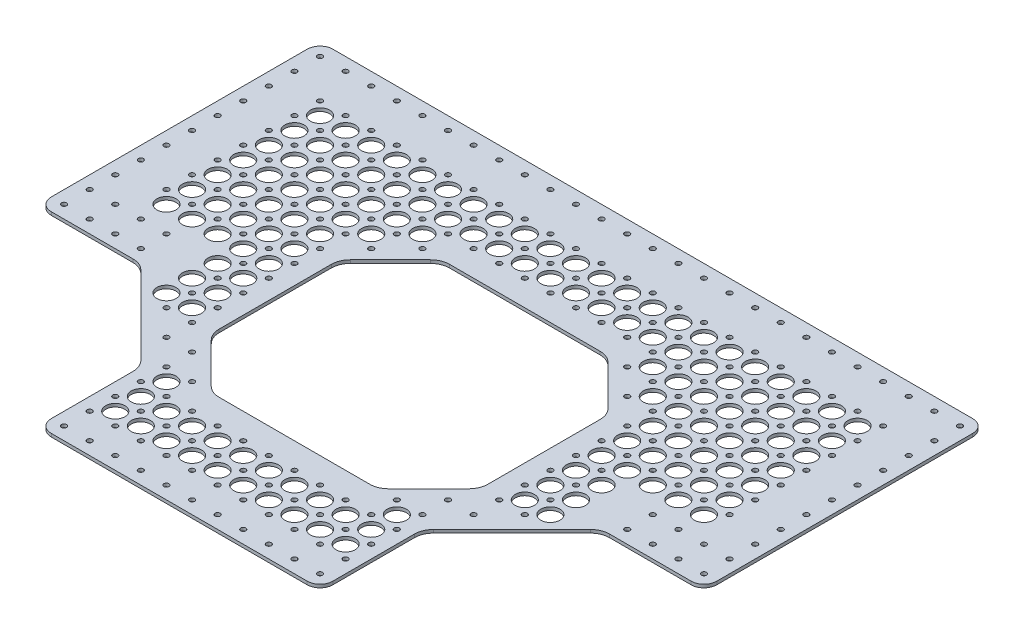
from build123d import *

# Parameters (mm, degrees)
SKETCH1_R           = 2.54
BOSS_EXTRUDE1_DEPTH = 3.175
SKETCH2_W           = 762
SKETCH2_H           = 25.4
CUT_EXTRUDE1_DEPTH  = 241.3
SKETCH3_W           = 266.7
SKETCH3_H           = 177.8
CUT_EXTRUDE2_DEPTH  = 3.175
BOSS_EXTRUDE2_DEPTH = 3.175
CUT_EXTRUDE3_DEPTH  = 3.175
SKETCH8_R           = 2.54
SKETCH8_R_2         = 9.525
CUT_EXTRUDE5_DEPTH  = 3.175
FILLET1_R           = 12.7
FILLET2_R           = 19.05


with BuildPart() as part:
    # Sketch1 → Boss-Extrude1 (new body)
    with BuildSketch(Plane(origin=(0, 0, 0), x_dir=(1, 0, 0), z_dir=(0, 1, 0))):
        Polygon((0, 101.6), (0, 0), (-88.904535599, -88.904535599), (-177.804535599, -88.904535599), (-190.504535599, -88.904535599), (-190.504535599, -419.104535599), (-177.804535599, -419.104535599), (-88.904535599, -419.104535599), (0, -508.009071197), (0, -609.609071197), (279.4, -609.609071197), (279.4, -508.009071197), (368.304535599, -419.104535599), (469.904535599, -419.104535599), (469.904535599, -88.904535599), (368.304535599, -88.904535599), (279.4, 0), (279.4, 101.6), align=None)
        with Locations((12.7, -596.909071197)):
            Circle(SKETCH1_R, mode=Mode.SUBTRACT)
        with Locations((38.1, -596.909071197)):
            Circle(SKETCH1_R, mode=Mode.SUBTRACT)
        with Locations((63.5, -596.909071197)):
            Circle(SKETCH1_R, mode=Mode.SUBTRACT)
        with Locations((88.9, -596.909071197)):
            Circle(SKETCH1_R, mode=Mode.SUBTRACT)
        with Locations((114.3, -596.909071197)):
            Circle(SKETCH1_R, mode=Mode.SUBTRACT)
        with Locations((139.7, -596.909071197)):
            Circle(SKETCH1_R, mode=Mode.SUBTRACT)
        with Locations((-177.804535599, -406.404535599)):
            Circle(SKETCH1_R, mode=Mode.SUBTRACT)
        with Locations((-152.404535599, -406.404535599)):
            Circle(SKETCH1_R, mode=Mode.SUBTRACT)
        with Locations((-127.004535599, -406.404535599)):
            Circle(SKETCH1_R, mode=Mode.SUBTRACT)
        with Locations((-177.804535599, -381.004535599)):
            Circle(SKETCH1_R, mode=Mode.SUBTRACT)
        with Locations((-152.404535599, -381.004535599)):
            Circle(SKETCH1_R, mode=Mode.SUBTRACT)
        with Locations((-177.804535599, -355.604535599)):
            Circle(SKETCH1_R, mode=Mode.SUBTRACT)
        with Locations((-127.004535599, -381.004535599)):
            Circle(SKETCH1_R, mode=Mode.SUBTRACT)
        with Locations((-101.604535599, -406.404535599)):
            Circle(SKETCH1_R, mode=Mode.SUBTRACT)
        with Locations((-101.604535599, -381.004535599)):
            Circle(SKETCH1_R, mode=Mode.SUBTRACT)
        with Locations((-177.804535599, -330.204535599)):
            Circle(SKETCH1_R, mode=Mode.SUBTRACT)
        with Locations((-177.804535599, -304.804535599)):
            Circle(SKETCH1_R, mode=Mode.SUBTRACT)
        with Locations((-177.804535599, -279.404535599)):
            Circle(SKETCH1_R, mode=Mode.SUBTRACT)
        with Locations((165.1, -596.909071197)):
            Circle(SKETCH1_R, mode=Mode.SUBTRACT)
        with Locations((190.5, -596.909071197)):
            Circle(SKETCH1_R, mode=Mode.SUBTRACT)
        with Locations((215.9, -596.909071197)):
            Circle(SKETCH1_R, mode=Mode.SUBTRACT)
        with Locations((241.3, -596.909071197)):
            Circle(SKETCH1_R, mode=Mode.SUBTRACT)
        with Locations((266.7, -596.909071197)):
            Circle(SKETCH1_R, mode=Mode.SUBTRACT)
        with Locations((381.004535599, -406.404535599)):
            Circle(SKETCH1_R, mode=Mode.SUBTRACT)
        with Locations((381.004535599, -381.004535599)):
            Circle(SKETCH1_R, mode=Mode.SUBTRACT)
        with Locations((406.404535599, -406.404535599)):
            Circle(SKETCH1_R, mode=Mode.SUBTRACT)
        with Locations((431.804535599, -406.404535599)):
            Circle(SKETCH1_R, mode=Mode.SUBTRACT)
        with Locations((457.204535599, -406.404535599)):
            Circle(SKETCH1_R, mode=Mode.SUBTRACT)
        with Locations((406.404535599, -381.004535599)):
            Circle(SKETCH1_R, mode=Mode.SUBTRACT)
        with Locations((431.804535599, -381.004535599)):
            Circle(SKETCH1_R, mode=Mode.SUBTRACT)
        with Locations((457.204535599, -381.004535599)):
            Circle(SKETCH1_R, mode=Mode.SUBTRACT)
        with Locations((457.204535599, -355.604535599)):
            Circle(SKETCH1_R, mode=Mode.SUBTRACT)
        with Locations((457.204535599, -330.204535599)):
            Circle(SKETCH1_R, mode=Mode.SUBTRACT)
        with Locations((457.204535599, -304.804535599)):
            Circle(SKETCH1_R, mode=Mode.SUBTRACT)
        with Locations((457.204535599, -279.404535599)):
            Circle(SKETCH1_R, mode=Mode.SUBTRACT)
        with Locations((-177.804535599, -254.004535599)):
            Circle(SKETCH1_R, mode=Mode.SUBTRACT)
        with Locations((-177.804535599, -228.604535599)):
            Circle(SKETCH1_R, mode=Mode.SUBTRACT)
        with Locations((-177.804535599, -203.204535599)):
            Circle(SKETCH1_R, mode=Mode.SUBTRACT)
        with Locations((-177.804535599, -177.804535599)):
            Circle(SKETCH1_R, mode=Mode.SUBTRACT)
        with Locations((-177.804535599, -152.404535599)):
            Circle(SKETCH1_R, mode=Mode.SUBTRACT)
        with Locations((-152.404535599, -152.404535599)):
            Circle(SKETCH1_R, mode=Mode.SUBTRACT)
        with Locations((-177.804535599, -127.004535599)):
            Circle(SKETCH1_R, mode=Mode.SUBTRACT)
        with Locations((-152.404535599, -127.004535599)):
            Circle(SKETCH1_R, mode=Mode.SUBTRACT)
        with Locations((-127.004535599, -152.404535599)):
            Circle(SKETCH1_R, mode=Mode.SUBTRACT)
        with Locations((-127.004535599, -127.004535599)):
            Circle(SKETCH1_R, mode=Mode.SUBTRACT)
        with Locations((-177.804535599, -101.604535599)):
            Circle(SKETCH1_R, mode=Mode.SUBTRACT)
        with Locations((-101.604535599, -152.404535599)):
            Circle(SKETCH1_R, mode=Mode.SUBTRACT)
        with Locations((-76.204535599, -152.404535599)):
            Circle(SKETCH1_R, mode=Mode.SUBTRACT)
        with Locations((-101.604535599, -127.004535599)):
            Circle(SKETCH1_R, mode=Mode.SUBTRACT)
        with Locations((-76.204535599, -127.004535599)):
            Circle(SKETCH1_R, mode=Mode.SUBTRACT)
        with Locations((-50.804535599, -152.404535599)):
            Circle(SKETCH1_R, mode=Mode.SUBTRACT)
        with Locations((-25.404535599, -152.404535599)):
            Circle(SKETCH1_R, mode=Mode.SUBTRACT)
        with Locations((-50.804535599, -127.004535599)):
            Circle(SKETCH1_R, mode=Mode.SUBTRACT)
        with Locations((-25.404535599, -127.004535599)):
            Circle(SKETCH1_R, mode=Mode.SUBTRACT)
        with Locations((-0.004535599, -152.404535599)):
            Circle(SKETCH1_R, mode=Mode.SUBTRACT)
        with Locations((-0.004535599, -127.004535599)):
            Circle(SKETCH1_R, mode=Mode.SUBTRACT)
        with Locations((25.395464401, -152.404535599)):
            Circle(SKETCH1_R, mode=Mode.SUBTRACT)
        with Locations((50.795464401, -152.404535599)):
            Circle(SKETCH1_R, mode=Mode.SUBTRACT)
        with Locations((25.395464401, -127.004535599)):
            Circle(SKETCH1_R, mode=Mode.SUBTRACT)
        with Locations((50.795464401, -127.004535599)):
            Circle(SKETCH1_R, mode=Mode.SUBTRACT)
        with Locations((76.195464401, -152.404535599)):
            Circle(SKETCH1_R, mode=Mode.SUBTRACT)
        with Locations((76.195464401, -127.004535599)):
            Circle(SKETCH1_R, mode=Mode.SUBTRACT)
        with Locations((101.595464401, -152.404535599)):
            Circle(SKETCH1_R, mode=Mode.SUBTRACT)
        with Locations((126.995464401, -152.404535599)):
            Circle(SKETCH1_R, mode=Mode.SUBTRACT)
        with Locations((101.595464401, -127.004535599)):
            Circle(SKETCH1_R, mode=Mode.SUBTRACT)
        with Locations((126.995464401, -127.004535599)):
            Circle(SKETCH1_R, mode=Mode.SUBTRACT)
        with Locations((12.7, 88.9)):
            Circle(SKETCH1_R, mode=Mode.SUBTRACT)
        with Locations((38.1, 88.9)):
            Circle(SKETCH1_R, mode=Mode.SUBTRACT)
        with Locations((63.5, 88.9)):
            Circle(SKETCH1_R, mode=Mode.SUBTRACT)
        with Locations((88.9, 88.9)):
            Circle(SKETCH1_R, mode=Mode.SUBTRACT)
        with Locations((114.3, 88.9)):
            Circle(SKETCH1_R, mode=Mode.SUBTRACT)
        with Locations((139.7, 88.9)):
            Circle(SKETCH1_R, mode=Mode.SUBTRACT)
        with Locations((152.395464401, -152.404535599)):
            Circle(SKETCH1_R, mode=Mode.SUBTRACT)
        with Locations((177.795464401, -152.404535599)):
            Circle(SKETCH1_R, mode=Mode.SUBTRACT)
        with Locations((152.395464401, -127.004535599)):
            Circle(SKETCH1_R, mode=Mode.SUBTRACT)
        with Locations((177.795464401, -127.004535599)):
            Circle(SKETCH1_R, mode=Mode.SUBTRACT)
        with Locations((203.195464401, -152.404535599)):
            Circle(SKETCH1_R, mode=Mode.SUBTRACT)
        with Locations((203.195464401, -127.004535599)):
            Circle(SKETCH1_R, mode=Mode.SUBTRACT)
        with Locations((228.595464401, -152.404535599)):
            Circle(SKETCH1_R, mode=Mode.SUBTRACT)
        with Locations((253.995464401, -152.404535599)):
            Circle(SKETCH1_R, mode=Mode.SUBTRACT)
        with Locations((228.595464401, -127.004535599)):
            Circle(SKETCH1_R, mode=Mode.SUBTRACT)
        with Locations((253.995464401, -127.004535599)):
            Circle(SKETCH1_R, mode=Mode.SUBTRACT)
        with Locations((279.395464401, -152.404535599)):
            Circle(SKETCH1_R, mode=Mode.SUBTRACT)
        with Locations((304.795464401, -152.404535599)):
            Circle(SKETCH1_R, mode=Mode.SUBTRACT)
        with Locations((279.395464401, -127.004535599)):
            Circle(SKETCH1_R, mode=Mode.SUBTRACT)
        with Locations((304.795464401, -127.004535599)):
            Circle(SKETCH1_R, mode=Mode.SUBTRACT)
        with Locations((457.204535599, -254.004535599)):
            Circle(SKETCH1_R, mode=Mode.SUBTRACT)
        with Locations((457.204535599, -228.604535599)):
            Circle(SKETCH1_R, mode=Mode.SUBTRACT)
        with Locations((457.204535599, -203.204535599)):
            Circle(SKETCH1_R, mode=Mode.SUBTRACT)
        with Locations((457.204535599, -177.804535599)):
            Circle(SKETCH1_R, mode=Mode.SUBTRACT)
        with Locations((330.195464401, -152.404535599)):
            Circle(SKETCH1_R, mode=Mode.SUBTRACT)
        with Locations((330.195464401, -127.004535599)):
            Circle(SKETCH1_R, mode=Mode.SUBTRACT)
        with Locations((355.595464401, -152.404535599)):
            Circle(SKETCH1_R, mode=Mode.SUBTRACT)
        with Locations((380.995464401, -152.404535599)):
            Circle(SKETCH1_R, mode=Mode.SUBTRACT)
        with Locations((355.595464401, -127.004535599)):
            Circle(SKETCH1_R, mode=Mode.SUBTRACT)
        with Locations((380.995464401, -127.004535599)):
            Circle(SKETCH1_R, mode=Mode.SUBTRACT)
        with Locations((406.395464401, -152.404535599)):
            Circle(SKETCH1_R, mode=Mode.SUBTRACT)
        with Locations((406.395464401, -127.004535599)):
            Circle(SKETCH1_R, mode=Mode.SUBTRACT)
        with Locations((431.795464401, -152.404535599)):
            Circle(SKETCH1_R, mode=Mode.SUBTRACT)
        with Locations((457.204535599, -152.404535599)):
            Circle(SKETCH1_R, mode=Mode.SUBTRACT)
        with Locations((431.795464401, -127.004535599)):
            Circle(SKETCH1_R, mode=Mode.SUBTRACT)
        with Locations((457.204535599, -127.004535599)):
            Circle(SKETCH1_R, mode=Mode.SUBTRACT)
        with Locations((457.204535599, -101.604535599)):
            Circle(SKETCH1_R, mode=Mode.SUBTRACT)
        with Locations((165.1, 88.9)):
            Circle(SKETCH1_R, mode=Mode.SUBTRACT)
        with Locations((190.5, 88.9)):
            Circle(SKETCH1_R, mode=Mode.SUBTRACT)
        with Locations((215.9, 88.9)):
            Circle(SKETCH1_R, mode=Mode.SUBTRACT)
        with Locations((241.3, 88.9)):
            Circle(SKETCH1_R, mode=Mode.SUBTRACT)
        with Locations((266.7, 88.9)):
            Circle(SKETCH1_R, mode=Mode.SUBTRACT)
    extrude(amount=BOSS_EXTRUDE1_DEPTH)

    # Sketch2 → Cut-Extrude1 (cut)
    with BuildSketch(Plane(origin=(0, 0, -101.6), x_dir=(-1, 0, 0), z_dir=(0, 0, -1))):
        with Locations((-129.535464401, 0)):
            Rectangle(SKETCH2_W, SKETCH2_H)
    extrude(amount=-CUT_EXTRUDE1_DEPTH, mode=Mode.SUBTRACT)

    # Sketch3 → Cut-Extrude2 (cut)
    with BuildSketch(Plane(origin=(0, 3.175, 0), x_dir=(1, 0, 0), z_dir=(0, 1, 0))):
        with Locations((139.7, -406.404535599)):
            Rectangle(SKETCH3_W, SKETCH3_H)
    extrude(amount=-CUT_EXTRUDE2_DEPTH, mode=Mode.SUBTRACT)

    # Sketch4 → Boss-Extrude2 (add)
    with BuildSketch(Plane(origin=(0, 3.175, 0), x_dir=(1, 0, 0), z_dir=(0, 1, 0))):
        Polygon((222.25, -495.304535599), (273.05, -444.504535599), (273.05, -495.304535599), align=None)
        Polygon((6.35, -495.304535599), (6.35, -444.504535599), (57.15, -495.304535599), align=None)
    extrude(amount=-BOSS_EXTRUDE2_DEPTH)

    # Sketch7 → Cut-Extrude3 (cut)
    with BuildSketch(Plane(origin=(0, 3.175, 0), x_dir=(1, 0, 0), z_dir=(0, 1, 0))):
        Polygon((6.35, -317.504535599), (57.15, -266.704535599), (222.25, -266.704535599), (273.05, -317.504535599), align=None)
    extrude(amount=-CUT_EXTRUDE3_DEPTH, mode=Mode.SUBTRACT)

    # Sketch8 → Cut-Extrude5 (cut)
    with BuildSketch(Plane(origin=(0, 3.175, 0), x_dir=(1, 0, 0), z_dir=(0, 1, 0))):
        with Locations((12.7, -596.909071197)):
            Circle(SKETCH8_R)
        with Locations((12.7, -571.509071197)):
            Circle(SKETCH8_R)
        with Locations((12.7, -546.109071197)):
            Circle(SKETCH8_R)
        with Locations((12.7, -520.709071197)):
            Circle(SKETCH8_R)
        with Locations((12.7, -495.309071197)):
            Circle(SKETCH8_R)
        with Locations((12.7, -469.909071197)):
            Circle(SKETCH8_R)
        with Locations((12.7, -292.109071197)):
            Circle(SKETCH8_R)
        with Locations((12.7, -266.709071197)):
            Circle(SKETCH8_R)
        with Locations((12.7, -241.309071197)):
            Circle(SKETCH8_R)
        with Locations((12.7, -215.909071197)):
            Circle(SKETCH8_R)
        with Locations((12.7, -190.509071197)):
            Circle(SKETCH8_R)
        with Locations((38.1, -190.509071197)):
            Circle(SKETCH8_R)
        with Locations((38.1, -215.909071197)):
            Circle(SKETCH8_R)
        with Locations((38.1, -241.309071197)):
            Circle(SKETCH8_R)
        with Locations((38.1, -266.709071197)):
            Circle(SKETCH8_R)
        with Locations((38.1, -495.309071197)):
            Circle(SKETCH8_R)
        with Locations((38.1, -520.709071197)):
            Circle(SKETCH8_R)
        with Locations((38.1, -546.109071197)):
            Circle(SKETCH8_R)
        with Locations((38.1, -571.509071197)):
            Circle(SKETCH8_R)
        with Locations((63.5, -190.509071197)):
            Circle(SKETCH8_R)
        with Locations((63.5, -215.909071197)):
            Circle(SKETCH8_R)
        with Locations((63.5, -241.309071197)):
            Circle(SKETCH8_R)
        with Locations((63.5, -520.709071197)):
            Circle(SKETCH8_R)
        with Locations((63.5, -546.109071197)):
            Circle(SKETCH8_R)
        with Locations((63.5, -571.509071197)):
            Circle(SKETCH8_R)
        with Locations((88.9, -190.509071197)):
            Circle(SKETCH8_R)
        with Locations((88.9, -215.909071197)):
            Circle(SKETCH8_R)
        with Locations((88.9, -241.309071197)):
            Circle(SKETCH8_R)
        with Locations((88.9, -520.709071197)):
            Circle(SKETCH8_R)
        with Locations((88.9, -546.109071197)):
            Circle(SKETCH8_R)
        with Locations((88.9, -571.509071197)):
            Circle(SKETCH8_R)
        with Locations((114.3, -190.509071197)):
            Circle(SKETCH8_R)
        with Locations((114.3, -215.909071197)):
            Circle(SKETCH8_R)
        with Locations((114.3, -241.309071197)):
            Circle(SKETCH8_R)
        with Locations((114.3, -520.709071197)):
            Circle(SKETCH8_R)
        with Locations((114.3, -546.109071197)):
            Circle(SKETCH8_R)
        with Locations((114.3, -571.509071197)):
            Circle(SKETCH8_R)
        with Locations((139.7, -190.509071197)):
            Circle(SKETCH8_R)
        with Locations((139.7, -215.909071197)):
            Circle(SKETCH8_R)
        with Locations((139.7, -241.309071197)):
            Circle(SKETCH8_R)
        with Locations((139.7, -520.709071197)):
            Circle(SKETCH8_R)
        with Locations((139.7, -546.109071197)):
            Circle(SKETCH8_R)
        with Locations((139.7, -571.509071197)):
            Circle(SKETCH8_R)
        with Locations((165.1, -190.509071197)):
            Circle(SKETCH8_R)
        with Locations((165.1, -215.909071197)):
            Circle(SKETCH8_R)
        with Locations((165.1, -241.309071197)):
            Circle(SKETCH8_R)
        with Locations((165.1, -520.709071197)):
            Circle(SKETCH8_R)
        with Locations((165.1, -546.109071197)):
            Circle(SKETCH8_R)
        with Locations((165.1, -571.509071197)):
            Circle(SKETCH8_R)
        with Locations((190.5, -190.509071197)):
            Circle(SKETCH8_R)
        with Locations((190.5, -215.909071197)):
            Circle(SKETCH8_R)
        with Locations((190.5, -241.309071197)):
            Circle(SKETCH8_R)
        with Locations((190.5, -520.709071197)):
            Circle(SKETCH8_R)
        with Locations((190.5, -546.109071197)):
            Circle(SKETCH8_R)
        with Locations((190.5, -571.509071197)):
            Circle(SKETCH8_R)
        with Locations((215.9, -190.509071197)):
            Circle(SKETCH8_R)
        with Locations((215.9, -215.909071197)):
            Circle(SKETCH8_R)
        with Locations((215.9, -241.309071197)):
            Circle(SKETCH8_R)
        with Locations((215.9, -520.709071197)):
            Circle(SKETCH8_R)
        with Locations((215.9, -546.109071197)):
            Circle(SKETCH8_R)
        with Locations((215.9, -571.509071197)):
            Circle(SKETCH8_R)
        with Locations((241.3, -190.509071197)):
            Circle(SKETCH8_R)
        with Locations((241.3, -215.909071197)):
            Circle(SKETCH8_R)
        with Locations((241.3, -241.309071197)):
            Circle(SKETCH8_R)
        with Locations((241.3, -266.709071197)):
            Circle(SKETCH8_R)
        with Locations((241.3, -495.309071197)):
            Circle(SKETCH8_R)
        with Locations((241.3, -520.709071197)):
            Circle(SKETCH8_R)
        with Locations((241.3, -546.109071197)):
            Circle(SKETCH8_R)
        with Locations((241.3, -571.509071197)):
            Circle(SKETCH8_R)
        with Locations((266.7, -190.509071197)):
            Circle(SKETCH8_R)
        with Locations((266.7, -215.909071197)):
            Circle(SKETCH8_R)
        with Locations((266.7, -241.309071197)):
            Circle(SKETCH8_R)
        with Locations((266.7, -266.709071197)):
            Circle(SKETCH8_R)
        with Locations((266.7, -292.109071197)):
            Circle(SKETCH8_R)
        with Locations((266.7, -469.909071197)):
            Circle(SKETCH8_R)
        with Locations((266.7, -495.309071197)):
            Circle(SKETCH8_R)
        with Locations((266.7, -520.709071197)):
            Circle(SKETCH8_R)
        with Locations((266.7, -546.109071197)):
            Circle(SKETCH8_R)
        with Locations((266.7, -571.509071197)):
            Circle(SKETCH8_R)
        with Locations((292.1, -190.509071197)):
            Circle(SKETCH8_R)
        with Locations((292.1, -215.909071197)):
            Circle(SKETCH8_R)
        with Locations((292.1, -241.309071197)):
            Circle(SKETCH8_R)
        with Locations((292.1, -266.709071197)):
            Circle(SKETCH8_R)
        with Locations((292.1, -292.109071197)):
            Circle(SKETCH8_R)
        with Locations((292.1, -469.909071197)):
            Circle(SKETCH8_R)
        with Locations((317.5, -190.509071197)):
            Circle(SKETCH8_R)
        with Locations((317.5, -215.909071197)):
            Circle(SKETCH8_R)
        with Locations((317.5, -241.309071197)):
            Circle(SKETCH8_R)
        with Locations((317.5, -266.709071197)):
            Circle(SKETCH8_R)
        with Locations((317.5, -292.109071197)):
            Circle(SKETCH8_R)
        with Locations((342.9, -190.509071197)):
            Circle(SKETCH8_R)
        with Locations((342.9, -215.909071197)):
            Circle(SKETCH8_R)
        with Locations((342.9, -241.309071197)):
            Circle(SKETCH8_R)
        with Locations((342.9, -266.709071197)):
            Circle(SKETCH8_R)
        with Locations((342.9, -292.109071197)):
            Circle(SKETCH8_R)
        with Locations((368.3, -190.509071197)):
            Circle(SKETCH8_R)
        with Locations((368.3, -215.909071197)):
            Circle(SKETCH8_R)
        with Locations((368.3, -241.309071197)):
            Circle(SKETCH8_R)
        with Locations((368.3, -266.709071197)):
            Circle(SKETCH8_R)
        with Locations((368.3, -292.109071197)):
            Circle(SKETCH8_R)
        with Locations((393.7, -190.509071197)):
            Circle(SKETCH8_R)
        with Locations((393.7, -215.909071197)):
            Circle(SKETCH8_R)
        with Locations((393.7, -241.309071197)):
            Circle(SKETCH8_R)
        with Locations((393.7, -266.709071197)):
            Circle(SKETCH8_R)
        with Locations((393.7, -292.109071197)):
            Circle(SKETCH8_R)
        with Locations((419.1, -190.509071197)):
            Circle(SKETCH8_R)
        with Locations((419.1, -215.909071197)):
            Circle(SKETCH8_R)
        with Locations((419.1, -241.309071197)):
            Circle(SKETCH8_R)
        with Locations((419.1, -266.709071197)):
            Circle(SKETCH8_R)
        with Locations((419.1, -292.109071197)):
            Circle(SKETCH8_R)
        with Locations((-12.7, -190.509071197)):
            Circle(SKETCH8_R)
        with Locations((-12.7, -215.909071197)):
            Circle(SKETCH8_R)
        with Locations((-12.7, -241.309071197)):
            Circle(SKETCH8_R)
        with Locations((-12.7, -266.709071197)):
            Circle(SKETCH8_R)
        with Locations((-12.7, -292.109071197)):
            Circle(SKETCH8_R)
        with Locations((-12.7, -469.909071197)):
            Circle(SKETCH8_R)
        with Locations((-38.1, -190.509071197)):
            Circle(SKETCH8_R)
        with Locations((-38.1, -215.909071197)):
            Circle(SKETCH8_R)
        with Locations((-38.1, -241.309071197)):
            Circle(SKETCH8_R)
        with Locations((-38.1, -266.709071197)):
            Circle(SKETCH8_R)
        with Locations((-38.1, -292.109071197)):
            Circle(SKETCH8_R)
        with Locations((-63.5, -190.509071197)):
            Circle(SKETCH8_R)
        with Locations((-63.5, -215.909071197)):
            Circle(SKETCH8_R)
        with Locations((-63.5, -241.309071197)):
            Circle(SKETCH8_R)
        with Locations((-63.5, -266.709071197)):
            Circle(SKETCH8_R)
        with Locations((-63.5, -292.109071197)):
            Circle(SKETCH8_R)
        with Locations((-88.9, -190.509071197)):
            Circle(SKETCH8_R)
        with Locations((-88.9, -215.909071197)):
            Circle(SKETCH8_R)
        with Locations((-88.9, -241.309071197)):
            Circle(SKETCH8_R)
        with Locations((-88.9, -266.709071197)):
            Circle(SKETCH8_R)
        with Locations((-88.9, -292.109071197)):
            Circle(SKETCH8_R)
        with Locations((-114.3, -190.509071197)):
            Circle(SKETCH8_R)
        with Locations((-114.3, -215.909071197)):
            Circle(SKETCH8_R)
        with Locations((-114.3, -241.309071197)):
            Circle(SKETCH8_R)
        with Locations((-114.3, -266.709071197)):
            Circle(SKETCH8_R)
        with Locations((-114.3, -292.109071197)):
            Circle(SKETCH8_R)
        with Locations((-139.7, -190.509071197)):
            Circle(SKETCH8_R)
        with Locations((-139.7, -215.909071197)):
            Circle(SKETCH8_R)
        with Locations((-139.7, -241.309071197)):
            Circle(SKETCH8_R)
        with Locations((-139.7, -266.709071197)):
            Circle(SKETCH8_R)
        with Locations((-139.7, -292.109071197)):
            Circle(SKETCH8_R)
        with Locations((-127.004535599, -203.2)):
            Circle(SKETCH8_R_2)
        with Locations((-101.604535599, -203.2)):
            Circle(SKETCH8_R_2)
        with Locations((-76.204535599, -203.2)):
            Circle(SKETCH8_R_2)
        with Locations((-50.804535599, -203.2)):
            Circle(SKETCH8_R_2)
        with Locations((-25.404535599, -203.2)):
            Circle(SKETCH8_R_2)
        with Locations((-0.004535599, -203.2)):
            Circle(SKETCH8_R_2)
        with Locations((25.395464401, -203.2)):
            Circle(SKETCH8_R_2)
        with Locations((50.795464401, -203.2)):
            Circle(SKETCH8_R_2)
        with Locations((76.195464401, -203.2)):
            Circle(SKETCH8_R_2)
        with Locations((101.595464401, -203.2)):
            Circle(SKETCH8_R_2)
        with Locations((126.995464401, -203.2)):
            Circle(SKETCH8_R_2)
        with Locations((152.395464401, -203.2)):
            Circle(SKETCH8_R_2)
        with Locations((177.795464401, -203.2)):
            Circle(SKETCH8_R_2)
        with Locations((203.195464401, -203.2)):
            Circle(SKETCH8_R_2)
        with Locations((228.595464401, -203.2)):
            Circle(SKETCH8_R_2)
        with Locations((253.995464401, -203.2)):
            Circle(SKETCH8_R_2)
        with Locations((279.395464401, -203.2)):
            Circle(SKETCH8_R_2)
        with Locations((304.795464401, -203.2)):
            Circle(SKETCH8_R_2)
        with Locations((330.195464401, -203.2)):
            Circle(SKETCH8_R_2)
        with Locations((355.595464401, -203.2)):
            Circle(SKETCH8_R_2)
        with Locations((380.995464401, -203.2)):
            Circle(SKETCH8_R_2)
        with Locations((406.395464401, -203.2)):
            Circle(SKETCH8_R_2)
        with Locations((-101.604535599, -228.6)):
            Circle(SKETCH8_R_2)
        with Locations((-76.204535599, -228.6)):
            Circle(SKETCH8_R_2)
        with Locations((-50.804535599, -228.6)):
            Circle(SKETCH8_R_2)
        with Locations((-25.404535599, -228.6)):
            Circle(SKETCH8_R_2)
        with Locations((-0.004535599, -228.6)):
            Circle(SKETCH8_R_2)
        with Locations((25.395464401, -228.6)):
            Circle(SKETCH8_R_2)
        with Locations((50.795464401, -228.6)):
            Circle(SKETCH8_R_2)
        with Locations((76.195464401, -228.6)):
            Circle(SKETCH8_R_2)
        with Locations((101.595464401, -228.6)):
            Circle(SKETCH8_R_2)
        with Locations((126.995464401, -228.6)):
            Circle(SKETCH8_R_2)
        with Locations((152.395464401, -228.6)):
            Circle(SKETCH8_R_2)
        with Locations((177.795464401, -228.6)):
            Circle(SKETCH8_R_2)
        with Locations((203.195464401, -228.6)):
            Circle(SKETCH8_R_2)
        with Locations((228.595464401, -228.6)):
            Circle(SKETCH8_R_2)
        with Locations((253.995464401, -228.6)):
            Circle(SKETCH8_R_2)
        with Locations((279.395464401, -228.6)):
            Circle(SKETCH8_R_2)
        with Locations((304.795464401, -228.6)):
            Circle(SKETCH8_R_2)
        with Locations((330.195464401, -228.6)):
            Circle(SKETCH8_R_2)
        with Locations((355.595464401, -228.6)):
            Circle(SKETCH8_R_2)
        with Locations((380.995464401, -228.6)):
            Circle(SKETCH8_R_2)
        with Locations((406.395464401, -228.6)):
            Circle(SKETCH8_R_2)
        with Locations((-101.604535599, -254)):
            Circle(SKETCH8_R_2)
        with Locations((-76.204535599, -254)):
            Circle(SKETCH8_R_2)
        with Locations((-50.804535599, -254)):
            Circle(SKETCH8_R_2)
        with Locations((-25.404535599, -254)):
            Circle(SKETCH8_R_2)
        with Locations((-0.004535599, -254)):
            Circle(SKETCH8_R_2)
        with Locations((25.395464401, -254)):
            Circle(SKETCH8_R_2)
        with Locations((-139.7, -317.509071197)):
            Circle(SKETCH8_R)
        with Locations((-114.3, -317.509071197)):
            Circle(SKETCH8_R)
        with Locations((-88.9, -317.509071197)):
            Circle(SKETCH8_R)
        with Locations((-63.5, -317.509071197)):
            Circle(SKETCH8_R)
        with Locations((-38.1, -317.509071197)):
            Circle(SKETCH8_R)
        with Locations((-12.7, -317.509071197)):
            Circle(SKETCH8_R)
        with Locations((-139.7, -342.909071197)):
            Circle(SKETCH8_R)
        with Locations((-114.3, -342.909071197)):
            Circle(SKETCH8_R)
        with Locations((-88.9, -342.909071197)):
            Circle(SKETCH8_R)
        with Locations((-63.5, -342.909071197)):
            Circle(SKETCH8_R)
        with Locations((-38.1, -342.909071197)):
            Circle(SKETCH8_R)
        with Locations((-12.7, -342.909071197)):
            Circle(SKETCH8_R)
        with Locations((-38.1, -368.309071197)):
            Circle(SKETCH8_R)
        with Locations((-12.7, -368.309071197)):
            Circle(SKETCH8_R)
        with Locations((-38.1, -393.709071197)):
            Circle(SKETCH8_R)
        with Locations((-12.7, -393.709071197)):
            Circle(SKETCH8_R)
        with Locations((-38.1, -419.109071197)):
            Circle(SKETCH8_R)
        with Locations((-12.7, -419.109071197)):
            Circle(SKETCH8_R)
        with Locations((-38.1, -444.509071197)):
            Circle(SKETCH8_R)
        with Locations((-12.7, -444.509071197)):
            Circle(SKETCH8_R)
        with Locations((292.1, -317.509071197)):
            Circle(SKETCH8_R)
        with Locations((317.5, -317.509071197)):
            Circle(SKETCH8_R)
        with Locations((342.9, -317.509071197)):
            Circle(SKETCH8_R)
        with Locations((368.3, -317.509071197)):
            Circle(SKETCH8_R)
        with Locations((393.7, -317.509071197)):
            Circle(SKETCH8_R)
        with Locations((419.1, -317.509071197)):
            Circle(SKETCH8_R)
        with Locations((292.1, -342.909071197)):
            Circle(SKETCH8_R)
        with Locations((317.5, -342.909071197)):
            Circle(SKETCH8_R)
        with Locations((342.9, -342.909071197)):
            Circle(SKETCH8_R)
        with Locations((368.3, -342.909071197)):
            Circle(SKETCH8_R)
        with Locations((393.7, -342.909071197)):
            Circle(SKETCH8_R)
        with Locations((419.1, -342.909071197)):
            Circle(SKETCH8_R)
        with Locations((292.1, -368.309071197)):
            Circle(SKETCH8_R)
        with Locations((317.5, -368.309071197)):
            Circle(SKETCH8_R)
        with Locations((292.1, -393.709071197)):
            Circle(SKETCH8_R)
        with Locations((317.5, -393.709071197)):
            Circle(SKETCH8_R)
        with Locations((292.1, -419.109071197)):
            Circle(SKETCH8_R)
        with Locations((317.5, -419.109071197)):
            Circle(SKETCH8_R)
        with Locations((292.1, -444.509071197)):
            Circle(SKETCH8_R)
        with Locations((317.5, -444.509071197)):
            Circle(SKETCH8_R)
        with Locations((101.595464401, -533.4)):
            Circle(SKETCH8_R_2)
        with Locations((126.995464401, -533.4)):
            Circle(SKETCH8_R_2)
        with Locations((152.395464401, -533.4)):
            Circle(SKETCH8_R_2)
        with Locations((177.795464401, -533.4)):
            Circle(SKETCH8_R_2)
        with Locations((203.195464401, -533.4)):
            Circle(SKETCH8_R_2)
        with Locations((228.595464401, -533.4)):
            Circle(SKETCH8_R_2)
        with Locations((279.395464401, -254)):
            Circle(SKETCH8_R_2)
        with Locations((304.795464401, -254)):
            Circle(SKETCH8_R_2)
        with Locations((330.195464401, -254)):
            Circle(SKETCH8_R_2)
        with Locations((355.595464401, -254)):
            Circle(SKETCH8_R_2)
        with Locations((380.995464401, -254)):
            Circle(SKETCH8_R_2)
        with Locations((406.395464401, -254)):
            Circle(SKETCH8_R_2)
        with Locations((-101.604535599, -279.4)):
            Circle(SKETCH8_R_2)
        with Locations((-76.204535599, -279.4)):
            Circle(SKETCH8_R_2)
        with Locations((-50.804535599, -279.4)):
            Circle(SKETCH8_R_2)
        with Locations((-25.404535599, -279.4)):
            Circle(SKETCH8_R_2)
        with Locations((-0.004535599, -279.4)):
            Circle(SKETCH8_R_2)
        with Locations((304.795464401, -279.4)):
            Circle(SKETCH8_R_2)
        with Locations((330.195464401, -279.4)):
            Circle(SKETCH8_R_2)
        with Locations((355.595464401, -279.4)):
            Circle(SKETCH8_R_2)
        with Locations((380.995464401, -279.4)):
            Circle(SKETCH8_R_2)
        with Locations((406.395464401, -279.4)):
            Circle(SKETCH8_R_2)
        with Locations((-101.604535599, -304.8)):
            Circle(SKETCH8_R_2)
        with Locations((-76.204535599, -304.8)):
            Circle(SKETCH8_R_2)
        with Locations((-50.804535599, -304.8)):
            Circle(SKETCH8_R_2)
        with Locations((-25.404535599, -304.8)):
            Circle(SKETCH8_R_2)
        with Locations((330.195464401, -304.8)):
            Circle(SKETCH8_R_2)
        with Locations((355.595464401, -304.8)):
            Circle(SKETCH8_R_2)
        with Locations((380.995464401, -304.8)):
            Circle(SKETCH8_R_2)
        with Locations((406.395464401, -304.8)):
            Circle(SKETCH8_R_2)
        with Locations((-101.604535599, -330.2)):
            Circle(SKETCH8_R_2)
        with Locations((-76.204535599, -330.2)):
            Circle(SKETCH8_R_2)
        with Locations((-50.804535599, -330.2)):
            Circle(SKETCH8_R_2)
        with Locations((-25.404535599, -330.2)):
            Circle(SKETCH8_R_2)
        with Locations((330.195464401, -330.2)):
            Circle(SKETCH8_R_2)
        with Locations((355.595464401, -330.2)):
            Circle(SKETCH8_R_2)
        with Locations((380.995464401, -330.2)):
            Circle(SKETCH8_R_2)
        with Locations((406.395464401, -330.2)):
            Circle(SKETCH8_R_2)
        with Locations((-101.604535599, -355.6)):
            Circle(SKETCH8_R_2)
        with Locations((-76.204535599, -355.6)):
            Circle(SKETCH8_R_2)
        with Locations((-50.804535599, -355.6)):
            Circle(SKETCH8_R_2)
        with Locations((-25.404535599, -355.6)):
            Circle(SKETCH8_R_2)
        with Locations((330.195464401, -355.6)):
            Circle(SKETCH8_R_2)
        with Locations((355.595464401, -355.6)):
            Circle(SKETCH8_R_2)
        with Locations((380.995464401, -355.6)):
            Circle(SKETCH8_R_2)
        with Locations((406.395464401, -355.6)):
            Circle(SKETCH8_R_2)
        with Locations((-25.404535599, -381)):
            Circle(SKETCH8_R_2)
        with Locations((330.195464401, -381)):
            Circle(SKETCH8_R_2)
        with Locations((-25.404535599, -406.4)):
            Circle(SKETCH8_R_2)
        with Locations((330.195464401, -406.4)):
            Circle(SKETCH8_R_2)
        with Locations((-25.404535599, -431.8)):
            Circle(SKETCH8_R_2)
        with Locations((330.195464401, -431.8)):
            Circle(SKETCH8_R_2)
        with Locations((50.795464401, -533.4)):
            Circle(SKETCH8_R_2)
        with Locations((76.195464401, -533.4)):
            Circle(SKETCH8_R_2)
        with Locations((50.795464401, -558.8)):
            Circle(SKETCH8_R_2)
        with Locations((76.195464401, -558.8)):
            Circle(SKETCH8_R_2)
        with Locations((101.595464401, -558.8)):
            Circle(SKETCH8_R_2)
        with Locations((126.995464401, -558.8)):
            Circle(SKETCH8_R_2)
        with Locations((152.395464401, -558.8)):
            Circle(SKETCH8_R_2)
        with Locations((177.795464401, -558.8)):
            Circle(SKETCH8_R_2)
        with Locations((203.195464401, -558.8)):
            Circle(SKETCH8_R_2)
        with Locations((228.595464401, -558.8)):
            Circle(SKETCH8_R_2)
        with Locations((-50.804535599, -381)):
            Circle(SKETCH8_R_2)
        with Locations((-127.004535599, -228.6)):
            Circle(SKETCH8_R_2)
        with Locations((-127.004535599, -254)):
            Circle(SKETCH8_R_2)
        with Locations((-127.004535599, -279.4)):
            Circle(SKETCH8_R_2)
        with Locations((-127.004535599, -304.8)):
            Circle(SKETCH8_R_2)
        with Locations((-127.004535599, -330.2)):
            Circle(SKETCH8_R_2)
        with Locations((-127.004535599, -355.6)):
            Circle(SKETCH8_R_2)
        with Locations((-50.804535599, -406.4)):
            Circle(SKETCH8_R_2)
        with Locations((-50.804535599, -431.8)):
            Circle(SKETCH8_R_2)
        with Locations((25.395464401, -533.4)):
            Circle(SKETCH8_R_2)
        with Locations((25.395464401, -558.8)):
            Circle(SKETCH8_R_2)
        with Locations((253.995464401, -533.4)):
            Circle(SKETCH8_R_2)
        with Locations((253.995464401, -558.8)):
            Circle(SKETCH8_R_2)
        with Locations((25.395464401, -508)):
            Circle(SKETCH8_R_2)
        with Locations((253.995464401, -508)):
            Circle(SKETCH8_R_2)
        with Locations((304.795464401, -431.8)):
            Circle(SKETCH8_R_2)
        with Locations((304.795464401, -406.4)):
            Circle(SKETCH8_R_2)
        with Locations((304.795464401, -381)):
            Circle(SKETCH8_R_2)
        with Locations((304.795464401, -355.6)):
            Circle(SKETCH8_R_2)
        with Locations((304.795464401, -330.2)):
            Circle(SKETCH8_R_2)
        with Locations((304.795464401, -304.8)):
            Circle(SKETCH8_R_2)
        with Locations((279.395464401, -279.4)):
            Circle(SKETCH8_R_2)
        with Locations((253.995464401, -254)):
            Circle(SKETCH8_R_2)
    extrude(amount=-CUT_EXTRUDE5_DEPTH, mode=Mode.SUBTRACT)

    # Fillet1
    fillet1_edges = [part.edges().sort_by_distance(p)[0] for p in [
        (-190.504535599, 1.5875, 419.104535599),
        (0, 1.5875, 609.609071197),
        (279.4, 1.5875, 609.609071197),
        (469.904535599, 1.5875, 419.104535599),
        (469.904535599, 1.5875, 139.7),
        (-190.504535599, 1.5875, 139.7),
    ]]
    fillet(fillet1_edges, radius=FILLET1_R)

    # Fillet2
    fillet2_edges = [part.edges().sort_by_distance(p)[0] for p in [
        (0, 1.5875, 508.009071197),
        (-88.904535599, 1.5875, 419.104535599),
        (222.25, 1.5875, 266.704535599),
        (273.05, 1.5875, 317.504535599),
        (273.05, 1.5875, 444.504535599),
        (222.25, 1.5875, 495.304535599),
        (57.15, 1.5875, 495.304535599),
        (6.35, 1.5875, 317.504535599),
        (57.15, 1.5875, 266.704535599),
        (6.35, 1.5875, 444.504535599),
        (279.4, 1.5875, 508.009071197),
        (368.304535599, 1.5875, 419.104535599),
    ]]
    fillet(fillet2_edges, radius=FILLET2_R)


solid = part.part
